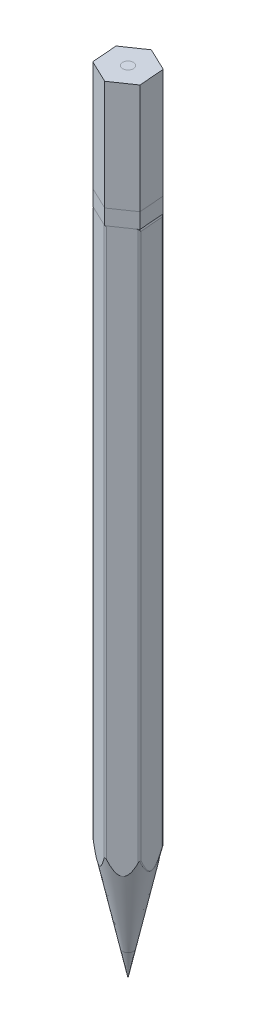
from build123d import *

# Parameters (mm, degrees)
BOSS_EXTRUDE1_DEPTH    = 180
SPLIT1_SURFACE_1_BACK  = 181.669
SPLIT1_SURFACE_1_DEPTH = 363.338
SPLIT1_SURFACE_2_BACK  = 181.669
SPLIT1_SURFACE_2_DEPTH = 363.338
SPLIT2_START           = 151.5
SPLIT2_OUTLINE_R       = 1.25
SPLIT2_DEPTH           = 3.5
SPLIT2_2_OUTLINE_R     = 1.25
SPLIT2_2_DEPTH         = 28.5
SPLIT2_START_2         = 155
SPLIT2_3_OUTLINE_R     = 1.25
SPLIT2_3_DEPTH         = 25
FILLET1_R              = 0.5


# Read off the part's stored shape, not the designer's step: Split2
with BuildPart() as part:
    # Sketch1 → Boss-Extrude1 (new body)
    with BuildSketch(Plane(origin=(0, 0, 0), x_dir=(1, 0, 0), z_dir=(0, 1, 0))):
        Polygon((5.210657733, -2.486439085), (4.758648279, 3.269342424), (-0.452009453, 5.75578151), (-5.210657733, 2.486439085), (-4.758648279, -3.269342424), (0.452009453, -5.75578151), align=None)
    extrude(amount=BOSS_EXTRUDE1_DEPTH)


with BuildPart() as body_2:
    # Split1: the piece behind the surface
    add(part.part)
    # Split1 surface: a surface, the sketch's curves swept straight by 363.338 mm
    with BuildLine(Plane(origin=(0, 180, 0), x_dir=(1, 0, 0), z_dir=(0, 1, 0)).offset(-SPLIT1_SURFACE_1_BACK), mode=Mode.PRIVATE) as split1_surface_1_path:
        CenterArc((0, 0), 1.25, 0, 360)
    split1_surface_1 = Shell.extrude(split1_surface_1_path.wire(), (0 * SPLIT1_SURFACE_1_DEPTH, 1 * SPLIT1_SURFACE_1_DEPTH, 0 * SPLIT1_SURFACE_1_DEPTH))
    split(bisect_by=split1_surface_1, keep=Keep.BOTTOM)


with BuildPart() as part_1:
    add(part.part)

    # Split1: split by a surface, the side it looks to stays
    # Split1 surface: a surface, the sketch's curves swept straight by 363.338 mm
    with BuildLine(Plane(origin=(0, 180, 0), x_dir=(1, 0, 0), z_dir=(0, 1, 0)).offset(-SPLIT1_SURFACE_2_BACK), mode=Mode.PRIVATE) as split1_surface_2_path:
        CenterArc((0, 0), 1.25, 0, 360)
    split1_surface_2 = Shell.extrude(split1_surface_2_path.wire(), (0 * SPLIT1_SURFACE_2_DEPTH, 1 * SPLIT1_SURFACE_2_DEPTH, 0 * SPLIT1_SURFACE_2_DEPTH))
    split(bisect_by=split1_surface_2, keep=Keep.TOP)


with BuildPart() as cut_revolve1_tool:
    # Sketch4 → Cut-Revolve1 (revolve)
    with BuildSketch(Plane.XY):
        Polygon((0, 0), (6.37669685, 30), (6.37669685, -2.036816597), (0, -2.036816597), align=None)
    revolve(axis=Axis((0, 0, 0), (0, 1, 0)))


with BuildPart() as part_2:
    add(part_1.part)

    # Cut-Revolve1: cut by cut_revolve1_tool
    add(cut_revolve1_tool.part, mode=Mode.SUBTRACT)


with BuildPart() as body_2_1:
    add(body_2.part)

    # Cut-Revolve1: cut by cut_revolve1_tool
    add(cut_revolve1_tool.part, mode=Mode.SUBTRACT)

    # Split2 2 outline → Split2 2 (cut)
    with BuildSketch(Plane(origin=(0, 0, 0), x_dir=(1, 0, 0), z_dir=(0, 1, 0)).offset(SPLIT2_START)):
        Polygon((5.210657733, -2.486439085), (4.758648279, 3.269342424), (-0.452009453, 5.75578151), (-5.210657733, 2.486439085), (-4.758648279, -3.269342424), (0.452009453, -5.75578151), align=None)
        Circle(SPLIT2_2_OUTLINE_R, mode=Mode.SUBTRACT)
    extrude(amount=SPLIT2_2_DEPTH, mode=Mode.SUBTRACT)

    # Fillet1
    fillet1_edges = [body_2_1.edges().sort_by_distance(p)[0] for p in [
        (-4.984648723, 23.523150549, 0.391506212),
        (-5.210657733, 89.331097301, -2.486439085),
        (-4.984653006, 151.5, 0.391451669),
        (-4.758648279, 89.331097301, 3.269342424),
        (4.984648723, 23.523150549, -0.391506212),
        (5.210657733, 89.331097301, 2.486439085),
        (4.984653006, 151.5, -0.391451669),
        (4.758648279, 89.331097301, -3.269342424),
        (0.452009453, 89.331097301, 5.75578151),
        (-0.452009453, 89.331097301, -5.75578151),
    ]]
    fillet(fillet1_edges, radius=FILLET1_R)


with BuildPart() as body_3:
    # Split2 outline → Split2 (new body)
    with BuildSketch(Plane(origin=(0, 0, 0), x_dir=(1, 0, 0), z_dir=(0, 1, 0)).offset(SPLIT2_START)):
        Polygon((-4.758648279, -3.269342424), (0.452009453, -5.75578151), (5.210657733, -2.486439085), (4.758648279, 3.269342424), (-0.452009453, 5.75578151), (-5.210657733, 2.486439085), align=None)
        Circle(SPLIT2_OUTLINE_R, mode=Mode.SUBTRACT)
    extrude(amount=SPLIT2_DEPTH)


with BuildPart() as body_4:
    # Split2 3 outline → Split2 3 (new body)
    with BuildSketch(Plane(origin=(0, 0, 0), x_dir=(1, 0, 0), z_dir=(0, 1, 0)).offset(SPLIT2_START_2)):
        Polygon((-4.758648279, -3.269342424), (0.452009453, -5.75578151), (5.210657733, -2.486439085), (4.758648279, 3.269342424), (-0.452009453, 5.75578151), (-5.210657733, 2.486439085), align=None)
        Circle(SPLIT2_3_OUTLINE_R, mode=Mode.SUBTRACT)
    extrude(amount=SPLIT2_3_DEPTH)


solid = Compound([part_2.part, body_2_1.part, body_3.part, body_4.part])
